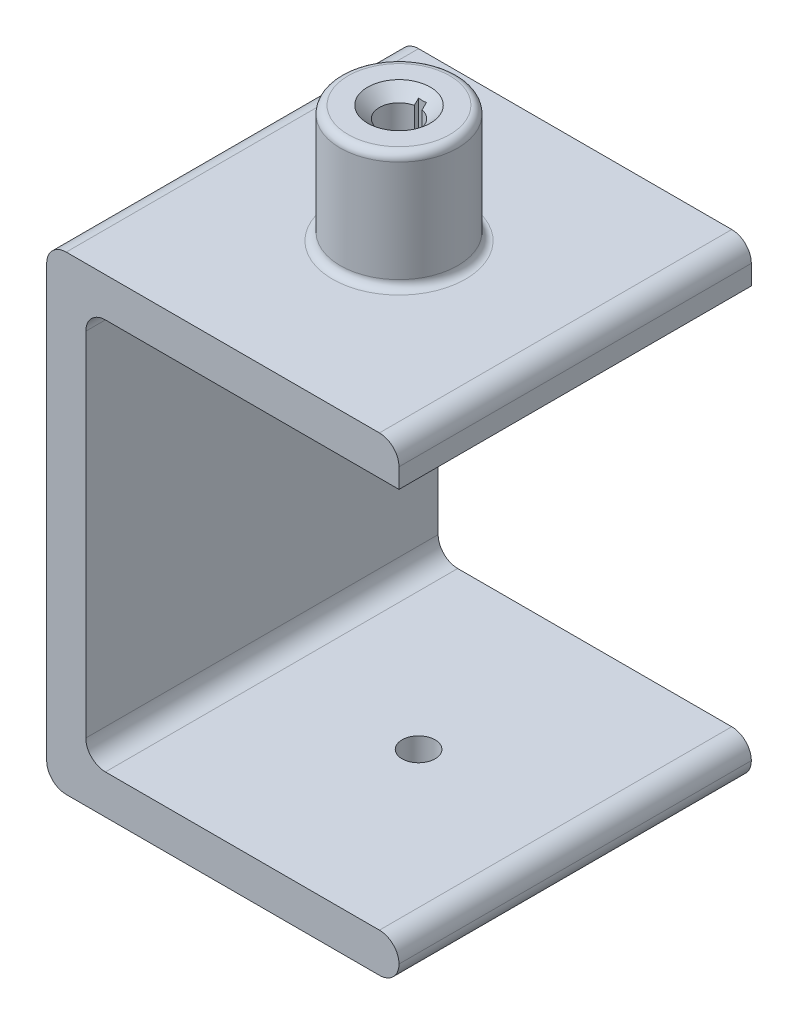
from build123d import *

# Parameters (mm, degrees)
BOSS_EXTRUDE1_DEPTH         = 57.15
FILLET1_R                   = 6.35
FILLET2_R                   = 6.35
FILLET3_R                   = 6.35
F_1_2_13_TAPPED_HOLE1_D     = 10.71626
F_1_2_13_TAPPED_HOLE1_DEPTH = 12.7
SKETCH7_R                   = 19.05
BOSS_EXTRUDE2_DEPTH         = 38.1
SKETCH8_R                   = 8.382
CUT_EXTRUDE1_DEPTH          = 1.524
FILLET4_R                   = 2.54


with BuildPart() as part:
    # Sketch1 → Boss-Extrude1 (new, symmetric)
    with BuildSketch(Plane.XY):
        Polygon((0, 0), (0, 152.4), (114.3, 152.4), (114.3, 139.7), (12.7, 139.7), (12.7, 12.7), (114.3, 12.7), (114.3, 0), align=None)
    extrude(amount=BOSS_EXTRUDE1_DEPTH, both=True)

    # Fillet1
    fillet1_edges = [part.edges().sort_by_distance(p)[0] for p in [
        (12.7, 139.7, 0),
        (12.7, 12.7, 0),
    ]]
    fillet(fillet1_edges, radius=FILLET1_R)

    # Fillet2
    fillet2_edges = [part.edges().sort_by_distance(p)[0] for p in [
        (0, 0, 0),
        (0, 152.4, 0),
    ]]
    fillet(fillet2_edges, radius=FILLET2_R)

    # Fillet3
    fillet3_edges = [part.edges().sort_by_distance(p)[0] for p in [
        (114.3, 152.4, 0),
        (114.3, 12.7, 0),
        (114.3, 0, 0),
    ]]
    fillet(fillet3_edges, radius=FILLET3_R - 0.0001)  # a hair under: the kernel refuses the full size

    # 1/2-13 Tapped Hole1
    with Locations(Plane(origin=(0, 0, 0), x_dir=(-1, 0, 0), z_dir=(0, -1, 0))):
        with Locations((-63.5, 0)):
            Hole(F_1_2_13_TAPPED_HOLE1_D / 2, depth=F_1_2_13_TAPPED_HOLE1_DEPTH)

    # Sketch7 → Boss-Extrude2 (add)
    with BuildSketch(Plane(origin=(0, 152.4, 0), x_dir=(1, 0, 0), z_dir=(0, 1, 0))):
        with Locations((57.15, 0)):
            Circle(SKETCH7_R)
        with BuildLine():
            Line((58.42, 6.221703947), (58.42, 7.62))
            Line((58.42, 7.62), (55.88, 7.62))
            Line((55.88, 7.62), (55.88, 6.221703947))
            ThreePointArc((55.88, 6.221703947), (57.15, -6.35), (58.42, 6.221703947))
        make_face(mode=Mode.SUBTRACT)
    extrude(amount=BOSS_EXTRUDE2_DEPTH)

    # Sketch8 → Cut-Extrude1 (cut)
    with BuildSketch(Plane(origin=(0, 152.4, 0), x_dir=(1, 0, 0), z_dir=(0, 1, 0))):
        with Locations((57.15, 0)):
            Circle(SKETCH8_R)
    extrude(amount=CUT_EXTRUDE1_DEPTH, mode=Mode.SUBTRACT)

    # Fillet4
    fillet4_edges = [part.edges().sort_by_distance(p)[0] for p in [
        (38.1, 152.4, 0),
        (38.1, 190.5, 0),
    ]]
    fillet(fillet4_edges, radius=FILLET4_R)

    # Chamfer1: read off the stored shape, not the designer's step
    # Chamfer1 outline → Chamfer1 (revolve, cut)
    with BuildSketch(Plane(origin=(57.15, 0, 0), x_dir=(1, 0, 0), z_dir=(0, 0, 1))):
        Polygon((6.349999964, 190.5), (6.349999964, 186.689999964), (10.16, 190.5), align=None)
    revolve(axis=Axis((57.15, 0, 0), (0, 1, 0)), mode=Mode.SUBTRACT)


solid = part.part
